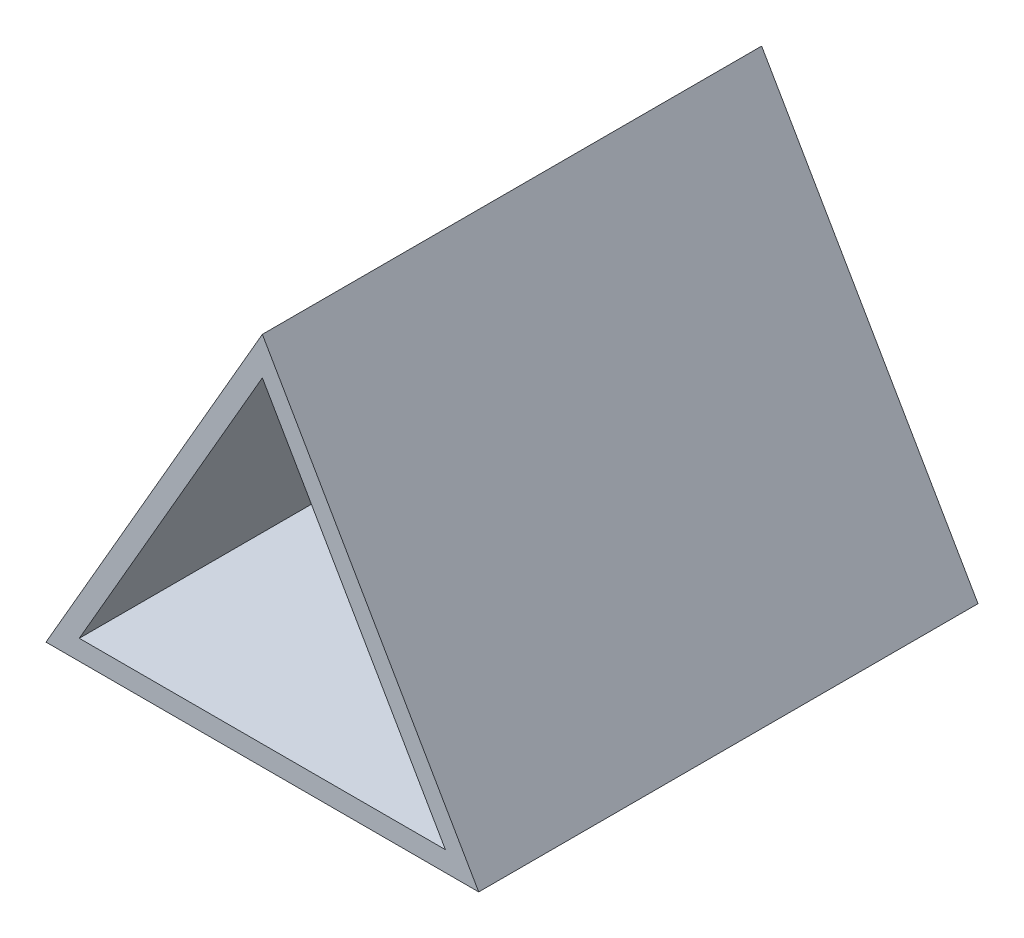
from build123d import *

# Parameters (mm, degrees)
BOSS_EXTRUDE5_DEPTH = 75


with BuildPart() as part:
    # Sketch3<7> → Boss-Extrude5 (new body)
    with BuildSketch(Plane.XY):
        Polygon((-35.275305952, -12.779067456), (29.724694048, -12.779067456), (-2.775305952, 43.51258379), align=None)
        Polygon((24.724694048, -9.779067456), (-30.275305952, -9.779067456), (-2.775305952, 37.852329752), align=None, mode=Mode.SUBTRACT)
    extrude(amount=-BOSS_EXTRUDE5_DEPTH)


solid = part.part
